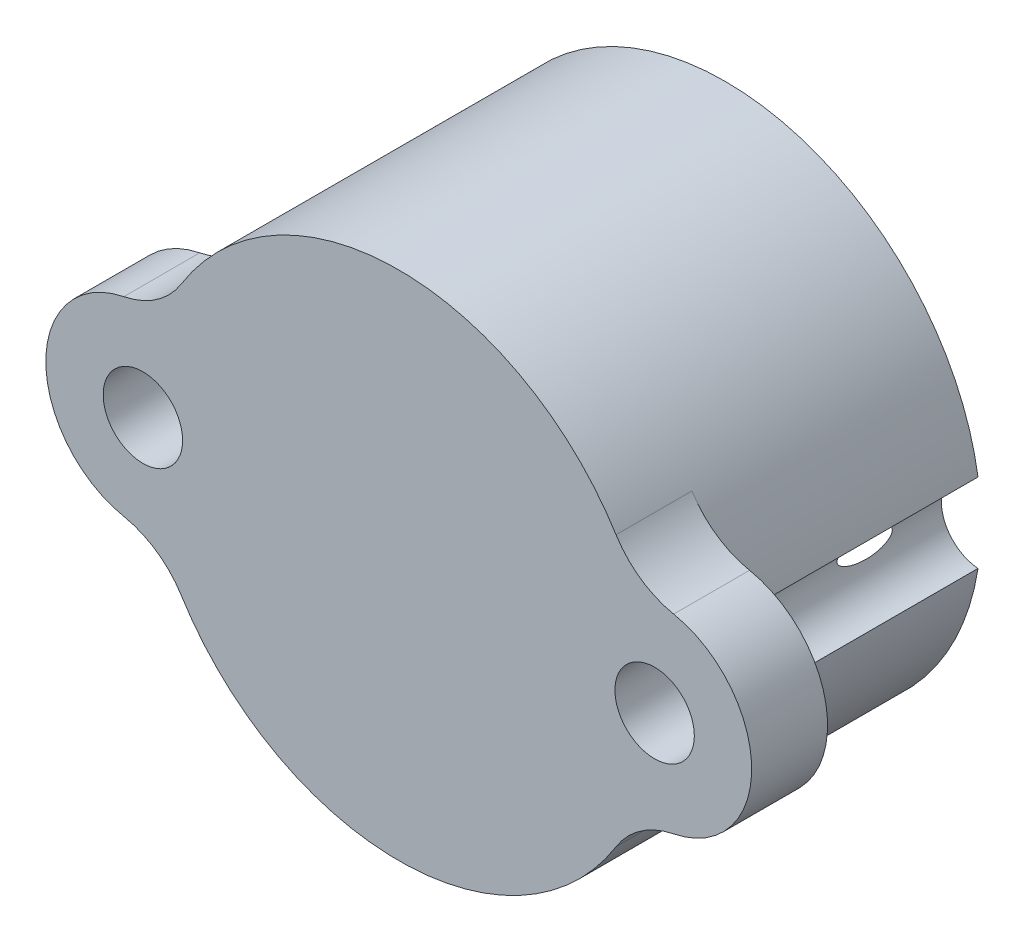
from build123d import *

# Parameters (mm, degrees)
ESQUISSE1_R             = 7.366
BOSS_EXTRU_1_DEPTH      = 9.398
BOSS_EXTRU_2_START      = -2.1844
BOSS_EXTRU_2_DEPTH      = 2.1844
CONG_1_R                = 2.54
ESQUISSE3_R             = 1.143
ENL_V_MAT_EXTRU_2_DEPTH = 16.678200152


with BuildPart() as part:
    # Esquisse1 → Boss.-Extru.1 (new body)
    with BuildSketch(Plane.XY):
        Circle(ESQUISSE1_R)
    extrude(amount=BOSS_EXTRU_1_DEPTH)

    # Esquisse2 → Boss.-Extru.2 (add)
    with BuildSketch(Plane.XY.offset(9.398).offset(BOSS_EXTRU_2_START)):
        with BuildLine():
            Line((7.366, 2.794), (6.815535195, 2.794))
            ThreePointArc((6.815535195, 2.794), (7.22707369, 1.423854584), (7.366, 0))
            Line((7.366, 0), (10.16, 0))
            ThreePointArc((10.16, 0), (9.341656347, 1.975656347), (7.366, 2.794))
        make_face()
        with BuildLine():
            Line((10.16, 0), (7.366, 0))
            ThreePointArc((7.366, 0), (7.22707369, -1.423854584), (6.815535195, -2.794))
            Line((6.815535195, -2.794), (7.366, -2.794))
            ThreePointArc((7.366, -2.794), (9.341656347, -1.975656347), (10.16, 0))
        make_face()
        with BuildLine():
            Line((-7.366, 0), (-10.16, 0))
            ThreePointArc((-10.16, 0), (-9.341656347, -1.975656347), (-7.366, -2.794))
            Line((-7.366, -2.794), (-6.815535195, -2.794))
            ThreePointArc((-6.815535195, -2.794), (-7.22707369, -1.423854584), (-7.366, 0))
        make_face()
        with BuildLine():
            Line((-6.815535195, 2.794), (-7.366, 2.794))
            ThreePointArc((-7.366, 2.794), (-9.341656347, 1.975656347), (-10.16, 0))
            Line((-10.16, 0), (-7.366, 0))
            ThreePointArc((-7.366, 0), (-7.22707369, 1.423854584), (-6.815535195, 2.794))
        make_face()
    extrude(amount=BOSS_EXTRU_2_DEPTH)

    # Congé1
    # the kernel refuses this fillet: 2.54 mm, written as the material it adds along each edge
    with BuildSketch(Plane(origin=(6.815535195, 2.794, 7.2136), x_dir=(-0.45524151464262924, 0.8903679932173465, 0), z_dir=(0, 0, 1)), Plane(origin=(-6.815535195, -2.794, 7.2136), x_dir=(0.4552415146426176, -0.8903679932173524, 0), z_dir=(0, 0, 1))) as cong_1_piece_1:
        with BuildLine():
            CenterArc((1.442130851, -2.531130754), CONG_1_R, 94.789504406, 46.813825589)
            Line((-0.548542223, -0.953531086), (-0.74760953, -0.795771119))
            ThreePointArc((-0.74760953, -0.795771119), (-0.476747902, -0.374484899), (-0.22615347, 0.115631345))
            Line((-0.22615347, 0.115631345), (0.021207807, 0.253113075))
            ThreePointArc((0.021207807, 0.253113075), (0.615026392, 0.228279187), (1.208844978, 0.253113075))
            Line((1.208844978, 0.253113075), (1.230052785, 0))
        make_face()
    extrude(amount=2.1844)
    with BuildSketch(Plane(origin=(6.815535195, -2.794, 7.2136), x_dir=(-0.4552415146426287, -0.8903679932173468, 0), z_dir=(0, 0, 1)), Plane(origin=(-6.815535195, 2.794, 7.2136), x_dir=(0.45524151464261825, 0.890367993217352, 0), z_dir=(0, 0, 1))) as cong_1_piece_2:
        with BuildLine():
            CenterArc((1.442130851, 2.531130754), CONG_1_R, 218.396670004, 46.813825589)
            Line((-0.548542223, 0.953531086), (-0.74760953, 0.795771119))
            ThreePointArc((-0.74760953, 0.795771119), (-0.476747902, 0.374484899), (-0.22615347, -0.115631345))
            Line((-0.22615347, -0.115631345), (0.021207807, -0.253113075))
            ThreePointArc((0.021207807, -0.253113075), (0.615026392, -0.228279187), (1.208844978, -0.253113075))
            Line((1.208844978, -0.253113075), (1.230052785, 0))
        make_face()
    extrude(amount=2.1844)

    # Esquisse3 → Enlèv. mat.-Extru.2 (cut, through all)
    with BuildSketch(Plane.XY.offset(9.398)):
        with Locations((-7.366, 0)):
            Circle(ESQUISSE3_R)
        with Locations((7.366, 0)):
            Circle(ESQUISSE3_R)
    extrude(amount=-ENL_V_MAT_EXTRU_2_DEPTH, mode=Mode.SUBTRACT)

    # Esquisse4 → Cut-Revolve1 (revolve, cut)
    with BuildSketch(Plane(origin=(0, 0, 0), x_dir=(0, 0, -1), z_dir=(1, 0, 0))):
        with BuildLine():
            Line((-8.4836, 0), (4.064, 0))
            ThreePointArc((4.064, 0), (-2.2098, 6.2738), (-8.4836, 0))
        make_face()
    revolve(axis=Axis((0, 0, 7.037287666), (0, 0, -1)), mode=Mode.SUBTRACT)


solid = part.part
